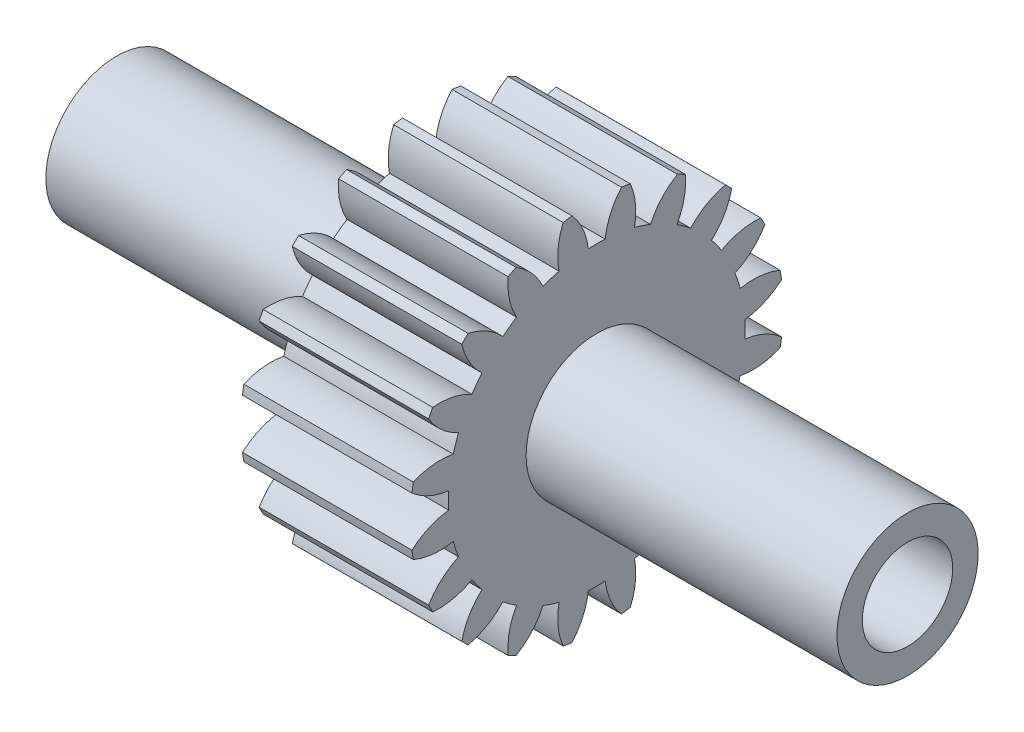
from build123d import *

# Parameters (mm, degrees)
BASPROSKE_W       = 15
BASPROSKE_H       = 16.5
TOOTHCUT_DEPTH    = 28.739863013
TEETHCUTS_COUNT   = 20
TEETHCUTS_ANGLE   = 342
HUBNEABOTSKE_R    = 6.25
HUBNEARBOTH_DEPTH = 27.5000254
HUBFAR_START      = 27.5000254
HUBFARSKE_R       = 6.25
HUBFAR_DEPTH      = 27.5000254
BORSKE_R          = 4
BORE_DEPTH        = 70.0000508


with BuildPart() as part:
    # BasProSke → Base-Revolve (revolve)
    with BuildSketch(Plane(origin=(0, 0, 0), x_dir=(1, 0, 0), z_dir=(0, 1, 0))):
        with Locations((7.5, 8.25)):
            Rectangle(BASPROSKE_W, BASPROSKE_H)
    revolve(axis=Axis((-10, 0, 0), (1, 0, 0)))

    # TooCutSke → ToothCut (cut, through all)
    with BuildSketch(Plane(origin=(0, 0, 0), x_dir=(0, 0, -1), z_dir=(1, 0, 0))):
        with BuildLine():
            ThreePointArc((0.74381438, 13.102904875), (0, 13.124), (-0.74381438, 13.102904875))
            ThreePointArc((-0.74381438, 13.102904875), (-1.226473103, 14.852072512), (-2.209965745, 16.376962373))
            ThreePointArc((-2.209965745, 16.376962373), (0, 16.5254), (2.209965745, 16.376962373))
            ThreePointArc((2.209965745, 16.376962373), (1.226473103, 14.852072512), (0.74381438, 13.102904875))
        make_face()
    toothcut = extrude(amount=TOOTHCUT_DEPTH, mode=Mode.SUBTRACT)

    # TeethCuts: ToothCut ×20 about axis
    teethcuts_axis = Axis((-10, 0, 0), (1, 0, 0))
    for i in range(1, TEETHCUTS_COUNT):
        add(toothcut.rotate(teethcuts_axis, i * TEETHCUTS_ANGLE / (TEETHCUTS_COUNT - 1)), mode=Mode.SUBTRACT)

    # HubNeaBotSke → HubNearBoth (add)
    with BuildSketch(Plane.ZY):
        Circle(HUBNEABOTSKE_R)
    extrude(amount=HUBNEARBOTH_DEPTH)

    # HubFarSke → HubFar (add)
    with BuildSketch(Plane(origin=(15, 0, 0), x_dir=(0, 0, -1), z_dir=(1, 0, 0)).offset(HUBFAR_START)):
        Circle(HUBFARSKE_R)
    extrude(amount=-HUBFAR_DEPTH)

    # BorSke → Bore (cut, symmetric)
    with BuildSketch(Plane(origin=(0, 0, 0), x_dir=(0, 0, -1), z_dir=(1, 0, 0))):
        Circle(BORSKE_R)
    extrude(amount=BORE_DEPTH, both=True, mode=Mode.SUBTRACT)


solid = part.part
